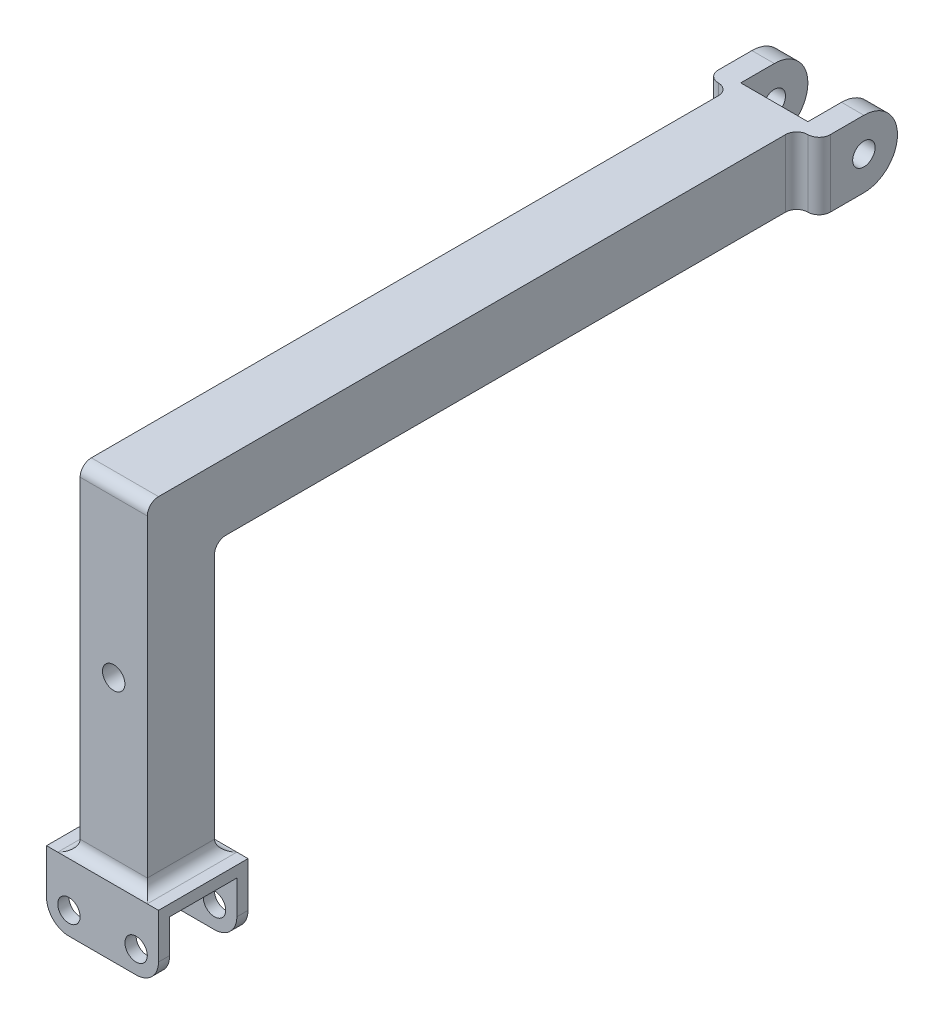
from build123d import *

# Parameters (mm, degrees)
SKETCH1_R           = 5
BOSS_EXTRUDE1_DEPTH = 50
SKETCH2_W           = 30
SKETCH2_H           = 30
CUT_EXTRUDE1_DEPTH  = 150
SKETCH3_R           = 5
CUT_EXTRUDE2_DEPTH  = 373.323783823
FILLET1_R           = 10
FILLET2_R           = 5
FILLET3_R           = 5
SKETCH4_R           = 5
CUT_EXTRUDE3_DEPTH  = 150


with BuildPart() as part:
    # Sketch1 → Boss-Extrude1 (new body)
    with BuildSketch(Plane(origin=(0, 0, 0), x_dir=(0, 0, -1), z_dir=(1, 0, 0))):
        with BuildLine():
            Line((-15, 165), (-15, 15))
            Line((-15, 15), (-20, 15))
            Line((-20, 15), (-20, -15))
            Line((-20, -15), (-15, -15))
            Line((-15, -15), (-15, 10))
            Line((-15, 10), (15, 10))
            Line((15, 10), (15, -15))
            Line((15, -15), (20, -15))
            Line((20, -15), (20, 15))
            Line((20, 15), (15, 15))
            Line((15, 15), (15, 135))
            Line((15, 135), (295, 135))
            ThreePointArc((295, 135), (310, 150), (295, 165))
            Line((295, 165), (-15, 165))
        make_face()
        with Locations((295, 150)):
            Circle(SKETCH1_R, mode=Mode.SUBTRACT)
    extrude(amount=BOSS_EXTRUDE1_DEPTH)

    # Sketch2 → Cut-Extrude1 (cut)
    with BuildSketch(Plane(origin=(0, 165, 0), x_dir=(1, 0, 0), z_dir=(0, 1, 0))):
        with Locations((25, 295)):
            Rectangle(SKETCH2_W, SKETCH2_H)
        with BuildLine():
            Line((0, 275), (5, 275))
            ThreePointArc((5, 275), (8.535533906, 273.535533906), (10, 270))
            Line((10, 270), (10, -15))
            Line((10, -15), (0, -15))
            Line((0, -15), (0, 275))
        make_face()
        with BuildLine():
            Line((50, -15), (40, -15))
            Line((40, -15), (40, 270))
            ThreePointArc((40, 270), (41.464466094, 273.535533906), (45, 275))
            Line((45, 275), (50, 275))
            Line((50, 275), (50, -15))
        make_face()
    extrude(amount=-CUT_EXTRUDE1_DEPTH, mode=Mode.SUBTRACT)

    # Sketch3 → Cut-Extrude2 (cut, through all)
    with BuildSketch(Plane.XY.offset(20)):
        with Locations((10, -5)):
            Circle(SKETCH3_R)
        with Locations((40, -5)):
            Circle(SKETCH3_R)
    extrude(amount=-CUT_EXTRUDE2_DEPTH, mode=Mode.SUBTRACT)

    # Fillet1
    fillet1_edges = [part.edges().sort_by_distance(p)[0] for p in [
        (0, -15, -17.5),
        (50, -15, 17.5),
        (0, -15, 17.5),
        (50, -15, -17.5),
    ]]
    fillet(fillet1_edges, radius=FILLET1_R)

    # Fillet2
    fillet2_edges = [part.edges().sort_by_distance(p)[0] for p in [
        (25, 165, 15),
        (25, 135, -15),
        (25, 15, -15),
        (25, 15, 15),
        (10, 15, 0),
        (40, 15, 0),
    ]]
    fillet(fillet2_edges, radius=FILLET2_R - 0.0001)  # a hair under: the kernel refuses the full size

    # Fillet3
    fillet3_edges = [part.edges().sort_by_distance(p)[0] for p in [
        (0, 150, -275),
        (50, 150, -275),
    ]]
    fillet(fillet3_edges, radius=FILLET3_R - 0.0001)  # a hair under: the kernel refuses the full size

    # Sketch4 → Cut-Extrude3 (cut)
    with BuildSketch(Plane.XY.offset(15)):
        with Locations((25, 90)):
            Circle(SKETCH4_R)
    extrude(amount=-CUT_EXTRUDE3_DEPTH, mode=Mode.SUBTRACT)


solid = part.part
